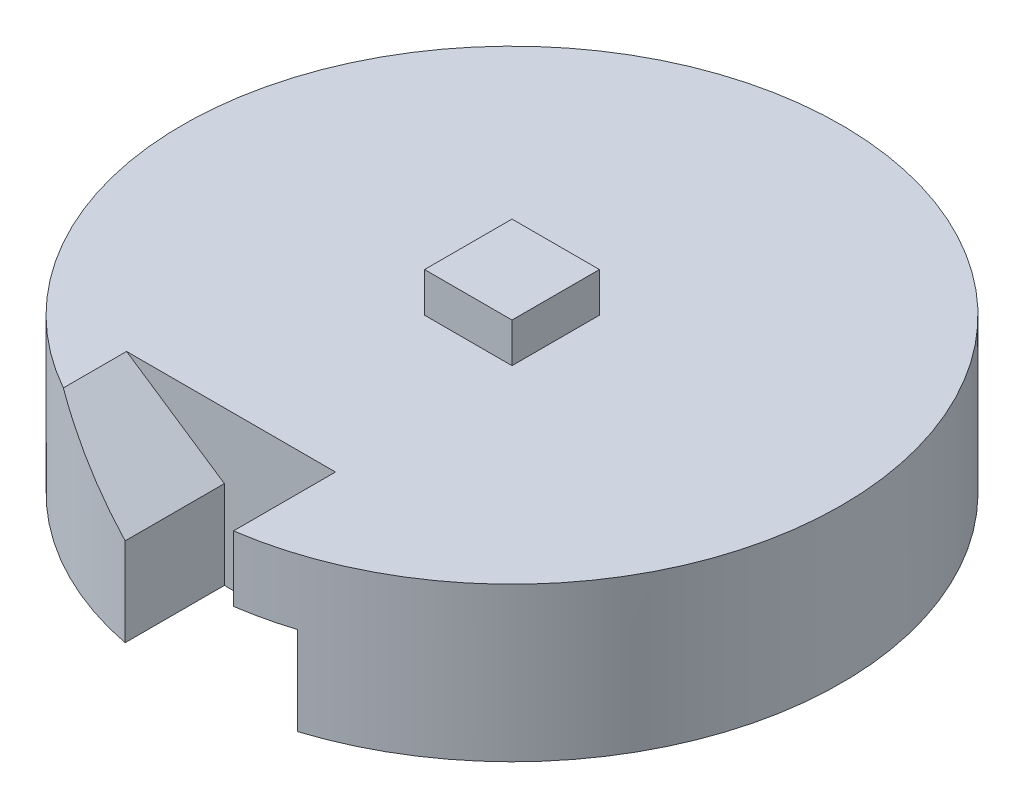
from build123d import *

# Parameters (mm, degrees)
SKETCH1_R           = 37.5
BOSS_EXTRUDE1_DEPTH = 17.5
CUT_EXTRUDE3_DEPTH  = 12
SKETCH9_W           = 9.95
SKETCH9_H           = 9.95
BOSS_EXTRUDE2_DEPTH = 22
SKETCH2_R           = 5
BOSS_EXTRUDE3_DEPTH = 5
CUT_EXTRUDE7_DEPTH  = 10
SKETCH12_R          = 3.025
CUT_EXTRUDE6_DEPTH  = 1.6


with BuildPart() as part:
    # Sketch1 → Boss-Extrude1 (new body)
    with BuildSketch(Plane(origin=(0, 0, 0), x_dir=(1, 0, 0), z_dir=(0, 1, 0))):
        Circle(SKETCH1_R)
    extrude(amount=BOSS_EXTRUDE1_DEPTH)

    # Sketch7 → Cut-Extrude3 (cut)
    with BuildSketch(Plane.XY.offset(37.5)):
        Polygon((5.409167976, 17.669921883), (-18.615329351, 17.669921883), (-7.232029952, 10.040131917), (-7.232029952, -0.186148413), (11.337754855, -0.186148413), (11.337754855, 10.05869391), (5.409167976, 10.05869391), align=None)
    extrude(amount=-CUT_EXTRUDE3_DEPTH, mode=Mode.SUBTRACT)

    # Sketch9 → Boss-Extrude2 (add)
    with BuildSketch(Plane(origin=(0, 0, 0), x_dir=(1, 0, 0), z_dir=(0, 1, 0))):
        Rectangle(SKETCH9_W, SKETCH9_H)
    extrude(amount=BOSS_EXTRUDE2_DEPTH)

    # Sketch2 → Boss-Extrude3 (add)
    with BuildSketch(Plane.XZ):
        Circle(SKETCH2_R)
    extrude(amount=BOSS_EXTRUDE3_DEPTH)

    # Sketch11 → Cut-Extrude7 (cut)
    with BuildSketch(Plane.XZ.offset(5)):
        Polygon((0.0345929, 1.483882371), (-2.4654071, 1.483882371), (-2.4654071, -1.516117629), (2.5345929, -1.516117629), (2.5345929, 1.483882371), align=None)
    extrude(amount=-CUT_EXTRUDE7_DEPTH, mode=Mode.SUBTRACT)

    # Sketch12 → Cut-Extrude6 (cut)
    with BuildSketch(Plane(origin=(0, 0, 0), x_dir=(-1, 0, 0), z_dir=(0, -1, 0))):
        with Locations((-30.018011531, -0.006767597)):
            Circle(SKETCH12_R)
        with Locations((29.981988469, -0.006767597)):
            Circle(SKETCH12_R)
    extrude(amount=-CUT_EXTRUDE6_DEPTH, mode=Mode.SUBTRACT)


solid = part.part
